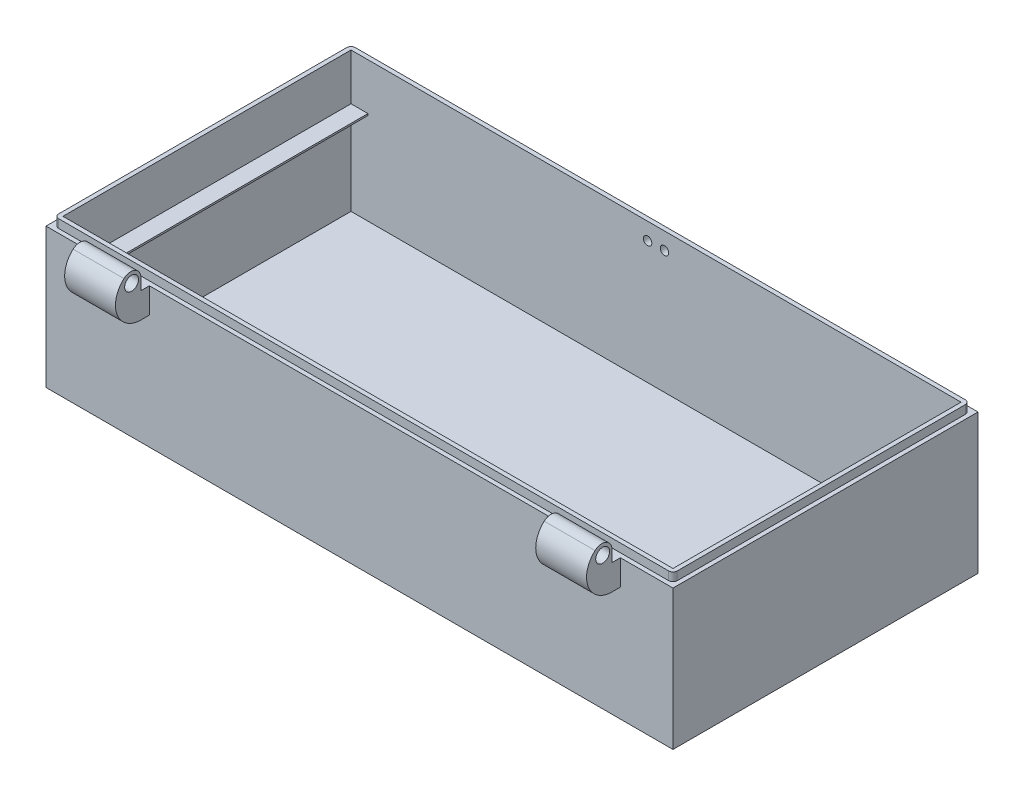
from build123d import *

# Parameters (mm, degrees)
BOSS_EXTRUDE1_DEPTH     = 85
SKETCH3_W               = 370
SKETCH3_H               = 5
BOSS_EXTRUDE2_DEPTH     = 87.5
SKETCH4_W               = 2.5
SKETCH4_H               = 5
CUT_EXTRUDE1_DEPTH      = 391.712490202
CUT_EXTRUDE2_DEPTH      = 271.90127353
CUT_EXTRUDE2_DEPTH_BACK = 271.90127353
SKETCH5_W               = 2.5
SKETCH5_H               = 5
FILLET1_R               = 2.5
SKETCH6_W               = 10
SKETCH6_H               = 170
BOSS_EXTRUDE3_DEPTH     = 10
FILLET2_SIZE            = 9
SKETCH8_W               = 30
SKETCH8_H               = 15
REVOLVE1_ANGLE          = 180
FILLET9_R               = 6
SKETCH12_W              = 5
SKETCH12_H              = 15
BOSS_EXTRUDE5_DEPTH     = 30
SKETCH9_R               = 4.1
CUT_EXTRUDE4_DEPTH      = 370.495940438
FILLET11_R              = 6
SKETCH13_R              = 2.5
CUT_EXTRUDE5_DEPTH      = 30


with BuildPart() as part:
    # Sketch2 → Boss-Extrude1 (new, symmetric)
    with BuildSketch(Plane.XY):
        Polygon((-185, 0), (185, 0), (185, 82.5), (182.5, 82.5), (182.5, 87.5), (180, 87.5), (180, 80.5), (180, 5), (-180, 5), (-180, 80.5), (-180, 87.5), (-182.5, 87.5), (-182.5, 82.5), (-185, 82.5), align=None)
    extrude(amount=BOSS_EXTRUDE1_DEPTH, both=True)

    # Sketch3 → Boss-Extrude2 (add)
    with BuildSketch(Plane(origin=(0, 0, 0), x_dir=(1, 0, 0), z_dir=(0, 1, 0))):
        with Locations((0, -87.5)):
            Rectangle(SKETCH3_W, SKETCH3_H)
        with Locations((0, 87.5)):
            Rectangle(SKETCH3_W, SKETCH3_H)
    extrude(amount=BOSS_EXTRUDE2_DEPTH)

    # Sketch4 → Cut-Extrude1 (cut, through all)
    with BuildSketch(Plane(origin=(185, 0, 0), x_dir=(0, 0, -1), z_dir=(1, 0, 0))):
        with Locations((-88.75, 85)):
            Rectangle(SKETCH4_W, SKETCH4_H)
        with Locations((88.75, 85)):
            Rectangle(SKETCH4_W, SKETCH4_H)
    extrude(amount=-CUT_EXTRUDE1_DEPTH, mode=Mode.SUBTRACT)

    # Sketch5 → Cut-Extrude2 (cut, two sides: drawn at the far end of the back side and taken through both)
    with BuildSketch(Plane(origin=(0, 0, -87.5), x_dir=(-1, 0, 0), z_dir=(0, 0, -1)).offset(-CUT_EXTRUDE2_DEPTH_BACK)):
        with Locations((-183.75, 85)):
            Rectangle(SKETCH5_W, SKETCH5_H)
        with Locations((183.75, 85)):
            Rectangle(SKETCH5_W, SKETCH5_H)
    extrude(amount=CUT_EXTRUDE2_DEPTH + CUT_EXTRUDE2_DEPTH_BACK, mode=Mode.SUBTRACT)

    # Fillet1
    fillet1_edges = [part.edges().sort_by_distance(p)[0] for p in [
        (182.5, 85, 87.5),
        (182.5, 85, -87.5),
        (-182.5, 85, 87.5),
        (-182.5, 85, -87.5),
    ]]
    fillet(fillet1_edges, radius=FILLET1_R)

    # Sketch6 → Boss-Extrude3 (add)
    with BuildSketch(Plane(origin=(0, 60, 0), x_dir=(1, 0, 0), z_dir=(0, 1, 0))):
        with Locations((-175, 0)):
            Rectangle(SKETCH6_W, SKETCH6_H)
        with Locations((175, 0)):
            Rectangle(SKETCH6_W, SKETCH6_H)
    extrude(amount=-BOSS_EXTRUDE3_DEPTH)

    # Fillet2
    fillet2_edges = [part.edges().sort_by_distance(p)[0] for p in [
        (-170, 50, 0),
        (170, 50, 0),
    ]]
    chamfer(fillet2_edges, length=FILLET2_SIZE)



with BuildPart() as body_2:
    # Sketch8 → Revolve1 (revolve, symmetric)
    with BuildSketch(Plane(origin=(0, 82.5, 0), x_dir=(1, 0, 0), z_dir=(0, 1, 0))) as revolve1_sk:
        with Locations((-139, -102.5)):
            Rectangle(SKETCH8_W, SKETCH8_H)
    revolve1 = revolve(axis=Axis((184.702128339, 82.5, 95), (-1, 0, 0)), revolution_arc=REVOLVE1_ANGLE / 2)
    revolve1 = revolve1 + revolve(revolve1_sk.sketch, axis=Axis((184.702128339, 82.5, 95), (1, 0, 0)), revolution_arc=REVOLVE1_ANGLE / 2)

    # Fillet9
    fillet9_edges = [body_2.edges().sort_by_distance(p)[0] for p in [
        (-139, 97.5, 95),
    ]]
    fillet(fillet9_edges, radius=FILLET9_R)


with BuildPart() as part_1:
    add(part.part)

    add(body_2.part)  # Boss-Extrude5 merges body 2
    # Sketch12 → Boss-Extrude5 (add)
    with BuildSketch(Plane.ZY.offset(154)):
        with Locations((92.5, 75)):
            Rectangle(SKETCH12_W, SKETCH12_H)
    boss_extrude5 = extrude(amount=-BOSS_EXTRUDE5_DEPTH)

    # Mirror4: Boss-Extrude5 across plane
    add(boss_extrude5.mirror(Plane(origin=(0, 0, 0), x_dir=(0, 0, 1), z_dir=(1, 0, 0))))

    # Mirror5: Revolve1 across plane
    add(revolve1.mirror(Plane(origin=(0, 0, 0), x_dir=(0, 0, 1), z_dir=(1, 0, 0))))

    # Sketch9 → Cut-Extrude4 (cut, through all)
    with BuildSketch(Plane.ZY.offset(154)):
        with Locations(Location((100.5, 89, 0), (0, 0, 180))):
            Circle(SKETCH9_R)
    extrude(amount=-CUT_EXTRUDE4_DEPTH, mode=Mode.SUBTRACT)

    # Fillet11
    fillet11_edges = [part_1.edges().sort_by_distance(p)[0] for p in [
        (139, 97.5, 95),
    ]]
    fillet(fillet11_edges, radius=FILLET11_R)

    # Sketch13 → Cut-Extrude5 (cut)
    with BuildSketch(Plane(origin=(0, 0, -90), x_dir=(-1, 0, 0), z_dir=(0, 0, -1))):
        with Locations((-5, 77.5)):
            Circle(SKETCH13_R)
        with Locations((5, 77.5)):
            Circle(SKETCH13_R)
    extrude(amount=-CUT_EXTRUDE5_DEPTH, mode=Mode.SUBTRACT)


solid = part_1.part
